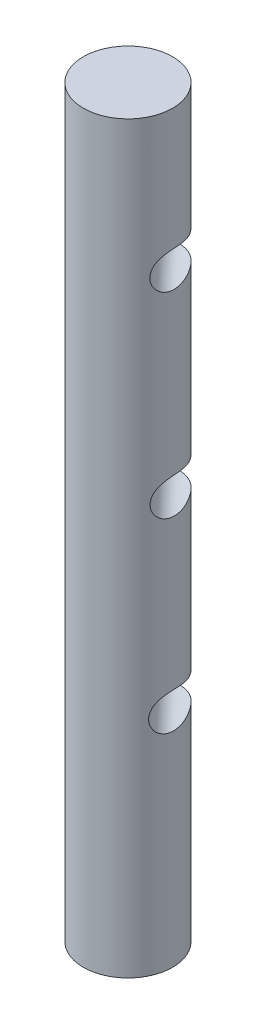
from build123d import *

# Parameters (mm, degrees)
SKETCH1_R             = 7.5
BOSS_EXTRUDE1_DEPTH   = 125
F_6_0MM_DOWEL_HOLE1_D = 6
F_6_0MM_DOWEL_HOLE2_D = 6
F_6_0MM_DOWEL_HOLE4_D = 6


with BuildPart() as part:
    # Sketch1 → Boss-Extrude1 (new body)
    with BuildSketch(Plane(origin=(0, 0, 0), x_dir=(1, 0, 0), z_dir=(0, 1, 0))):
        Circle(SKETCH1_R)
    extrude(amount=BOSS_EXTRUDE1_DEPTH)

    # Ø6.0mm Dowel Hole1 (through all)
    with Locations(Plane(origin=(63.132736794, -54.57945397, -196.68406129), x_dir=(0, 1, 0), z_dir=(-0.6877356402744372, 5.528266780359317e-15, -0.725961217350011))):
        with Locations((156.087532559, -175.318700205)):
            Hole(F_6_0MM_DOWEL_HOLE1_D / 2)

    # Ø6.0mm Dowel Hole2 (through all)
    with Locations(Plane(origin=(63.132736794, -54.57945397, -196.68406129), x_dir=(0, 1, 0), z_dir=(-0.6877356402744372, 5.528266780359317e-15, -0.725961217350011))):
        with Locations((123.097877986, -175.280990501)):
            Hole(F_6_0MM_DOWEL_HOLE2_D / 2)

    # Ø6.0mm Dowel Hole4 (through all)
    with Locations(Plane(origin=(63.132736794, -54.57945397, -196.68406129), x_dir=(0, 1, 0), z_dir=(-0.6877356402744372, 5.528266780359317e-15, -0.725961217350011))):
        with Locations((91.901828901, -175.454462016)):
            Hole(F_6_0MM_DOWEL_HOLE4_D / 2)


solid = part.part
